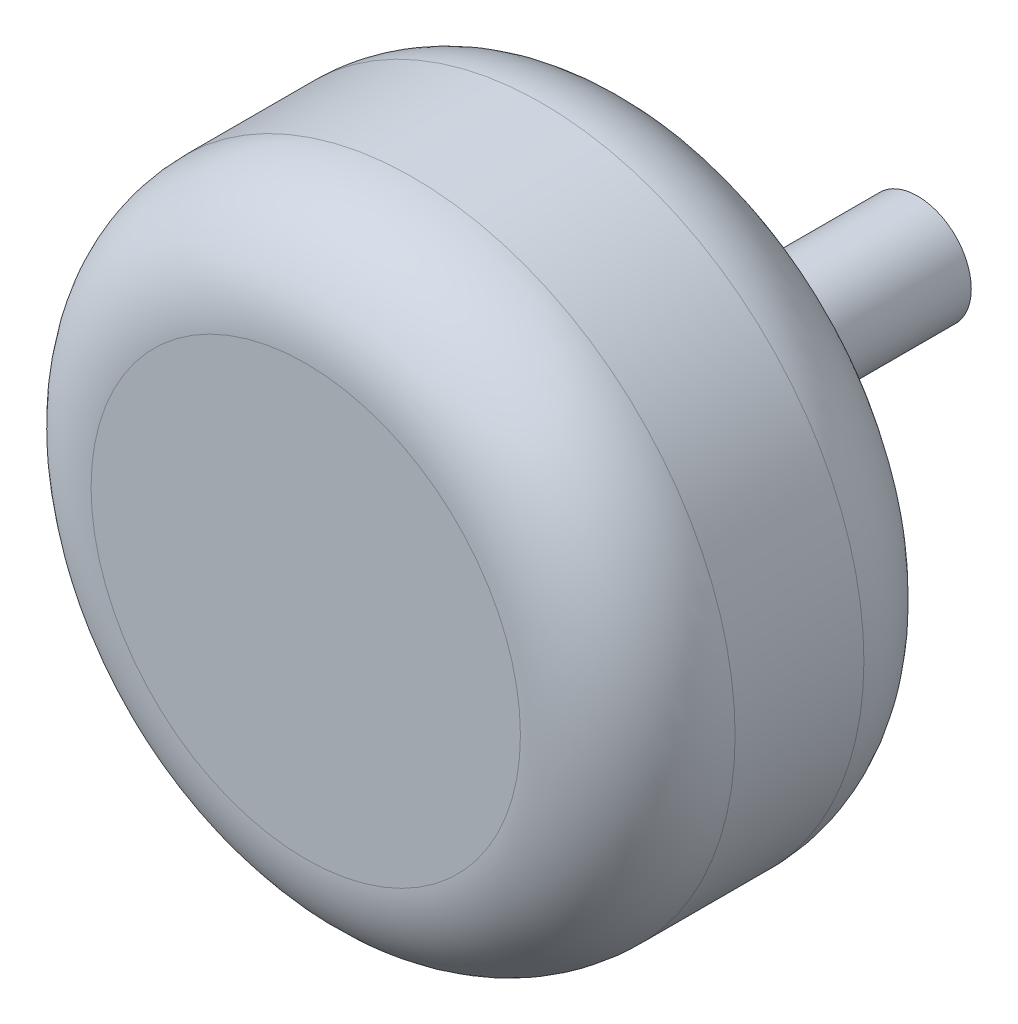
from build123d import *

# Parameters (mm, degrees)
SKETCH_1_R      = 30
EXTRUDE_1_DEPTH = 32
FILLET_1_R      = 10
SKETCH_2_R      = 5
EXTRUDE_2_DEPTH = 25


with BuildPart() as part:
    # Эскиз1 → Бобышка-Вытянуть1 (new body)
    with BuildSketch(Plane.XY):
        Circle(SKETCH_1_R)
    extrude(amount=EXTRUDE_1_DEPTH)

    # Скругление1
    fillet_1_edges = [part.edges().sort_by_distance(p)[0] for p in [
        (-30, 0, 0),
        (-30, 0, 32),
    ]]
    fillet(fillet_1_edges, radius=FILLET_1_R)

    # Эскиз2 → Бобышка-Вытянуть2 (add)
    with BuildSketch(Plane(origin=(0, 0, 0), x_dir=(-1, 0, 0), z_dir=(0, 0, -1))):
        Circle(SKETCH_2_R)
        with BuildLine():
            Line((-1.198957881, 2.75), (1.198957881, 2.75))
            ThreePointArc((1.198957881, 2.75), (3, 0), (1.198957881, -2.75))
            Line((1.198957881, -2.75), (-1.198957881, -2.75))
            ThreePointArc((-1.198957881, -2.75), (-3, 0), (-1.198957881, 2.75))
        make_face(mode=Mode.SUBTRACT)
    extrude(amount=EXTRUDE_2_DEPTH)


solid = part.part
